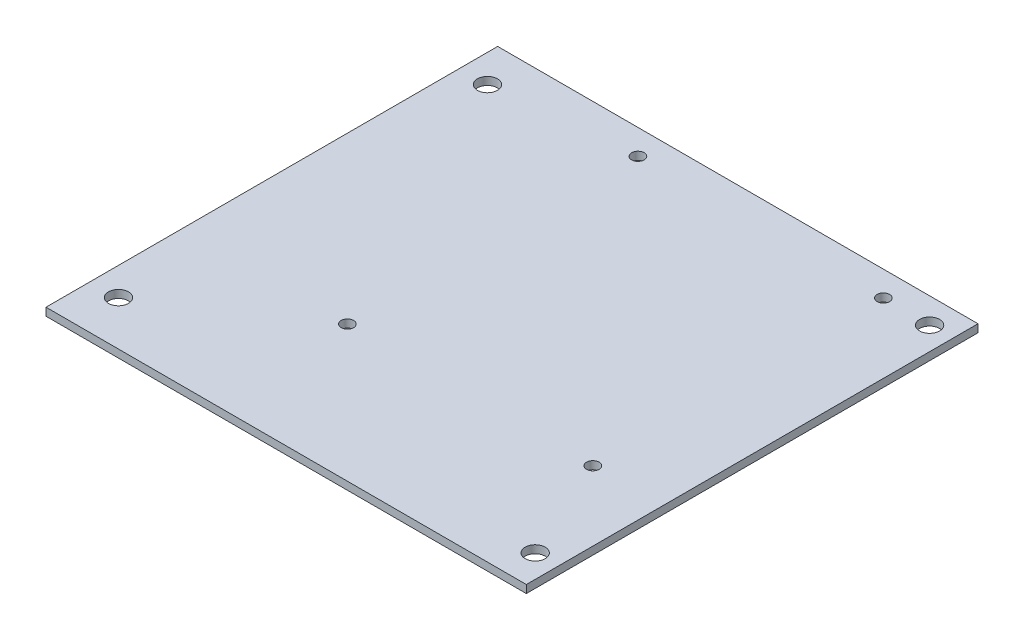
from build123d import *

# Parameters (mm, degrees)
SKETCH1_W               = 96.89
SKETCH1_H               = 90.17
PCB_DEPTH               = 1.57
SKETCH2_R               = 2
M3_MOUNTING_HOLES_DEPTH = 1.57
SKETCH5_W               = 0.5
SKETCH5_H               = 90.17
CUT_EXTRUDE1_DEPTH      = 127.49657684
SKETCH8_R               = 1.25
RPI_MOUNTING_HOLE_DEPTH = 10


with BuildPart() as part:
    # Sketch1 → PCB (new body)
    with BuildSketch(Plane(origin=(0, 0, 0), x_dir=(1, 0, 0), z_dir=(0, 1, 0))):
        with Locations((16.200949951, 63.633996534)):
            Rectangle(SKETCH1_W, SKETCH1_H)
    extrude(amount=PCB_DEPTH)

    # Sketch2 → M3 Mounting Holes (cut)
    with BuildSketch(Plane(origin=(0, 1.57, 0), x_dir=(1, 0, 0), z_dir=(0, 1, 0))):
        with Locations((59.565949951, 24.898996534)):
            Circle(SKETCH2_R)
        with Locations((-26.164050049, 27.438996534)):
            Circle(SKETCH2_R)
        with Locations((-26.164050049, 101.098996534)):
            Circle(SKETCH2_R)
        with Locations((59.565949951, 103.638996534)):
            Circle(SKETCH2_R)
    extrude(amount=-M3_MOUNTING_HOLES_DEPTH, mode=Mode.SUBTRACT)

    # Sketch5 → Cut-Extrude1 (cut, through all)
    with BuildSketch(Plane(origin=(0, 1.57, 0), x_dir=(1, 0, 0), z_dir=(0, 1, 0))):
        with Locations((-31.994050049, 63.633996534)):
            Rectangle(SKETCH5_W, SKETCH5_H)
        with Locations((64.395949951, 63.633996534)):
            Rectangle(SKETCH5_W, SKETCH5_H)
    extrude(amount=-CUT_EXTRUDE1_DEPTH, mode=Mode.SUBTRACT)

    # Sketch8 → RPi mounting hole (cut)
    with BuildSketch(Plane(origin=(0, 1.57, 0), x_dir=(1, 0, 0), z_dir=(0, 1, 0))):
        with Locations((1.255949951, 45.718996534)):
            Circle(SKETCH8_R)
        with Locations((50.255949951, 45.718996534)):
            Circle(SKETCH8_R)
        with Locations((1.255949951, 103.718996534)):
            Circle(SKETCH8_R)
        with Locations((50.255949951, 103.718996534)):
            Circle(SKETCH8_R)
    extrude(amount=-RPI_MOUNTING_HOLE_DEPTH, mode=Mode.SUBTRACT)


solid = part.part
